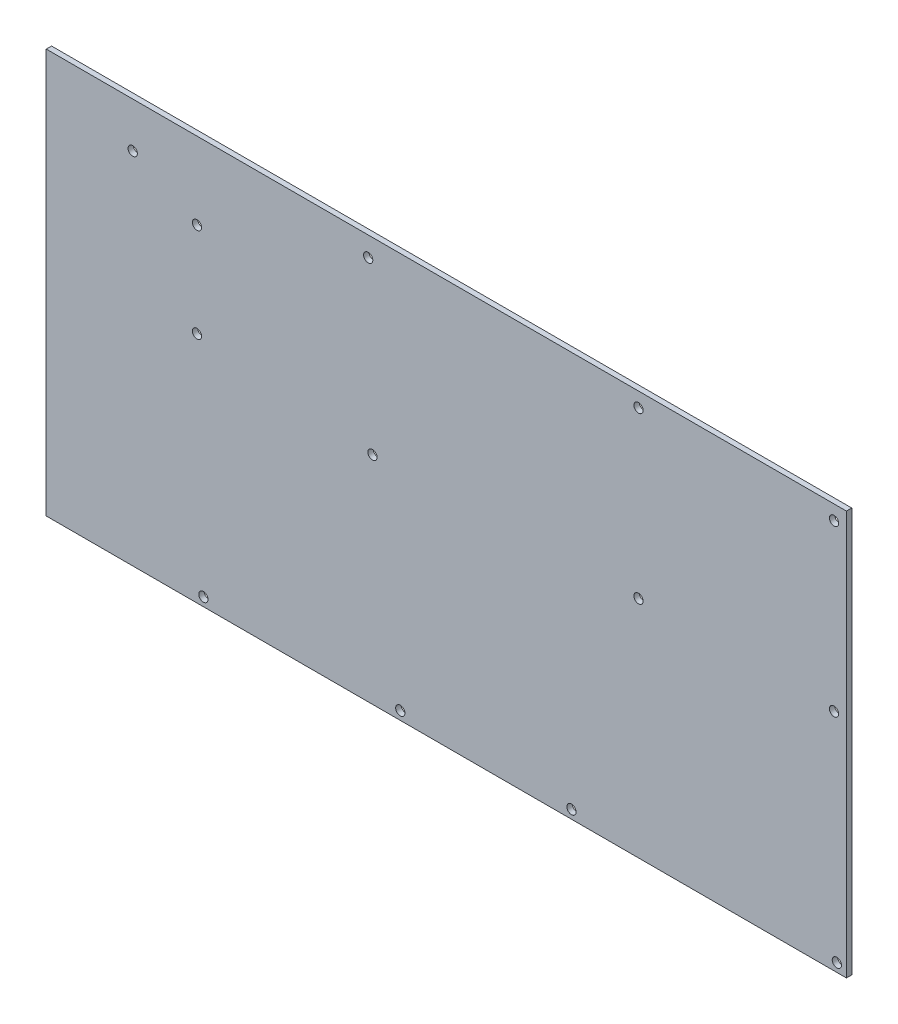
from build123d import *

# Parameters (mm, degrees)
BOSS_EXTRUDE1_START = 6
SKETCH1_W           = 237.4392
SKETCH1_H           = 119.9896
SKETCH1_R           = 1.3716
BOSS_EXTRUDE1_DEPTH = 1.5748


with BuildPart() as part:
    # Sketch1 → Boss-Extrude1 (new body)
    with BuildSketch(Plane.XY.offset(BOSS_EXTRUDE1_START)):
        with Locations((78.797443137, 19.612784314)):
            Rectangle(SKETCH1_W, SKETCH1_H)
        with Locations((193.834043137, 75.289584314)):
            Circle(SKETCH1_R, mode=Mode.SUBTRACT)
        with Locations((135.815363137, 75.289584314)):
            Circle(SKETCH1_R, mode=Mode.SUBTRACT)
        with Locations((193.834043137, 26.292984314)):
            Circle(SKETCH1_R, mode=Mode.SUBTRACT)
        with Locations((135.820443137, 26.292984314)):
            Circle(SKETCH1_R, mode=Mode.SUBTRACT)
        with Locations((194.672243137, -37.842015686)):
            Circle(SKETCH1_R, mode=Mode.SUBTRACT)
        with Locations((115.932243137, -37.842015686)):
            Circle(SKETCH1_R, mode=Mode.SUBTRACT)
        with Locations((55.607243137, 73.790984314)):
            Circle(SKETCH1_R, mode=Mode.SUBTRACT)
        with Locations((56.877243137, 23.752984314)):
            Circle(SKETCH1_R, mode=Mode.SUBTRACT)
        with Locations((65.132243137, -37.842015686)):
            Circle(SKETCH1_R, mode=Mode.SUBTRACT)
        with Locations((4.807243137, 56.772984314)):
            Circle(SKETCH1_R, mode=Mode.SUBTRACT)
        with Locations((4.807243137, 28.832984314)):
            Circle(SKETCH1_R, mode=Mode.SUBTRACT)
        with Locations((6.712243137, -37.842015686)):
            Circle(SKETCH1_R, mode=Mode.SUBTRACT)
        with Locations((-14.271778871, 66.267235766)):
            Circle(SKETCH1_R, mode=Mode.SUBTRACT)
    extrude(amount=BOSS_EXTRUDE1_DEPTH)


solid = part.part
